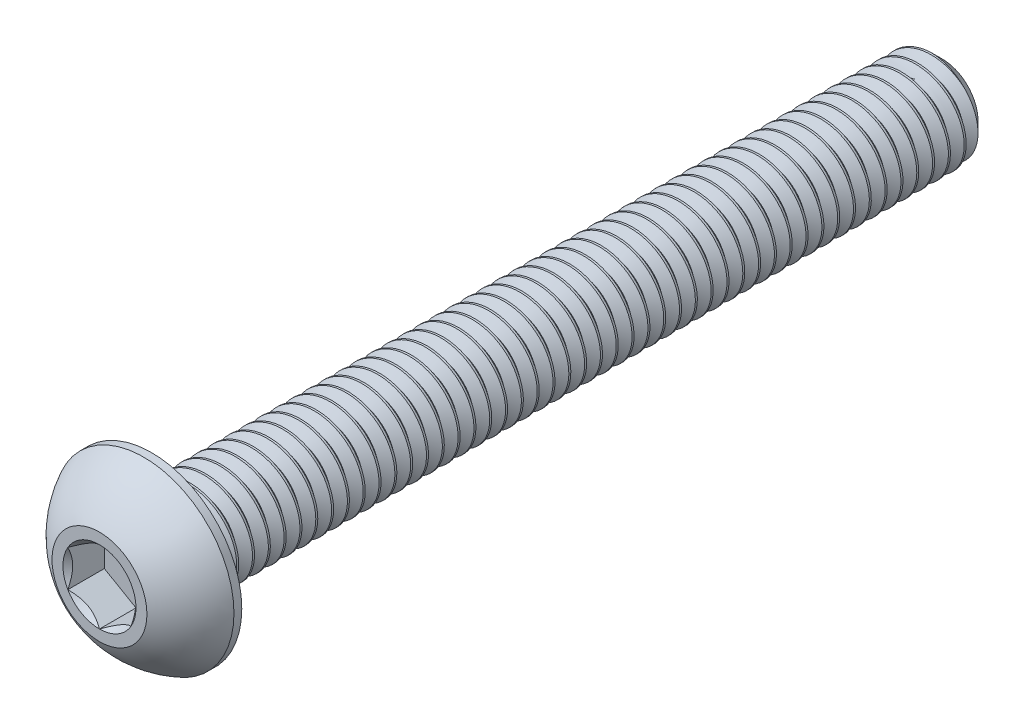
from build123d import *

# Parameters (mm, degrees)
SKETCH1_W          = 25
SKETCH1_H          = 1.5
CHAMFER1_SIZE      = 0.375
CUT_EXTRUDE2_DEPTH = 1.155
CUT_SWEEP1_PITCH   = 0.5


with BuildPart() as part:
    # Sketch1 → Revolve1 (revolve)
    with BuildSketch(Plane(origin=(0, 0, 0), x_dir=(0, 0, -1), z_dir=(1, 0, 0))):
        with Locations((14.15, 0.75)):
            Rectangle(SKETCH1_W, SKETCH1_H)
    revolve(axis=Axis((0, 0, -26.65), (0, 0, 1)))

    # Chamfer1
    chamfer1_edges = [part.edges().sort_by_distance(p)[0] for p in [
        (0, -1.5, -26.65),
    ]]
    chamfer(chamfer1_edges, length=CHAMFER1_SIZE)

    # Sketch7 → Revolve2 (revolve)
    with BuildSketch(Plane(origin=(0, 0, 0), x_dir=(0, 0, -1), z_dir=(1, 0, 0)), mode=Mode.PRIVATE) as revolve2_sk:
        with BuildLine():
            Line((1.4025, 2.85), (1.65, 2.85))
            Line((1.65, 2.85), (1.65, 0))
            Line((1.65, 0), (0, 0))
            Line((0, 0), (0, 1.5))
            ThreePointArc((0, 1.5), (0.59512511, 2.285251969), (1.4025, 2.85))
        make_face()
    revolve(revolve2_sk.sketch.rotate(Axis((0, 0, 0), (0, 0, -1)), 180), axis=Axis((0, 0, 0), (0, 0, -1)))

    # Sketch5 → Cut-Extrude2 (cut)
    with BuildSketch(Plane.XY):
        Polygon((1, -0.577350269), (1, 0.577350269), (0, 1.154700538), (-1, 0.577350269), (-1, -0.577350269), (0, -1.154700538), align=None)
    extrude(amount=-CUT_EXTRUDE2_DEPTH, mode=Mode.SUBTRACT)

    # Cut-Extrude3 cone 1 section (through the dimple's axis) → Cut-Extrude3 (revolve, cut)
    with BuildSketch(Plane(origin=(0, 0, 0), x_dir=(0, -1, 0), z_dir=(1, 0, 0))):
        Polygon((0, 0), (1.154700538, 0), (0, 1.154700538), align=None)
    revolve(axis=Axis((0, 0, 0), (0, 0, -1)), mode=Mode.SUBTRACT)

    # Cut-Sweep1: arcs per turn and ends read off the stored shape
    # Cut-Sweep1: the profile of Sketch2 profile screwed along a right-hand helix through 51 turns, 6 arcs to a turn; built about Z, then put on its axis
    cut_sweep1_z = Axis((0, 0, 0), (0, 0, 1))
    cut_sweep1_corners = [(1.5003, 0, 0.375173205), (1.5003, 0, -0.062673205), (1.175240474, 0, 0.125), (1.175240474, 0, 0.1875)]
    with BuildLine(mode=Mode.PRIVATE) as cut_sweep1_profile:
        Line(cut_sweep1_corners[0], cut_sweep1_corners[1])
        Line(cut_sweep1_corners[1], cut_sweep1_corners[2])
        Line(cut_sweep1_corners[2], cut_sweep1_corners[3])
        Line(cut_sweep1_corners[3], cut_sweep1_corners[0])
    cut_sweep1_cap = Face(cut_sweep1_profile.wire())
    cut_sweep1_turn_angles = [0, 30, 60, 90, 120, 150, 180, 210, 240, 270, 300, 330, 360]
    cut_sweep1_turn_weights = [1, 0.8660254037844387, 1, 0.8660254037844387, 1, 0.8660254037844387, 1, 0.8660254037844387, 1, 0.8660254037844387, 1, 0.8660254037844387, 1]
    cut_sweep1_turn_rails = [Edge.make_bspline([Vector(p[0], p[1], 0).rotate(cut_sweep1_z, cut_sweep1_turn_angles[k]) / cut_sweep1_turn_weights[k] + Vector(0, 0, p[2] + CUT_SWEEP1_PITCH * cut_sweep1_turn_angles[k] / 360) for k in range(13)], [0, 0, 0, 1, 1, 2, 2, 3, 3, 4, 4, 5, 5, 6, 6, 6], 2, cut_sweep1_turn_weights) for p in cut_sweep1_corners]
    cut_sweep1_turn_sides = [Face.make_surface_from_curves(cut_sweep1_turn_rails[p[0]], cut_sweep1_turn_rails[p[1]]) for p in [(0, 1), (1, 2), (2, 3), (3, 0)]]
    cut_sweep1 = Plane(origin=(0, 0, -26.65), x_dir=(0, 1, 0), z_dir=(0, 0, 1)) * Solid(Shell([*[p.moved(Location((0, 0, CUT_SWEEP1_PITCH * i))) for i in range(51) for p in cut_sweep1_turn_sides], cut_sweep1_cap, cut_sweep1_cap.rotate(cut_sweep1_z, 18360).moved(Location((0, 0, CUT_SWEEP1_PITCH * 18360 / 360)))]))
    add(cut_sweep1, mode=Mode.SUBTRACT)


solid = part.part
